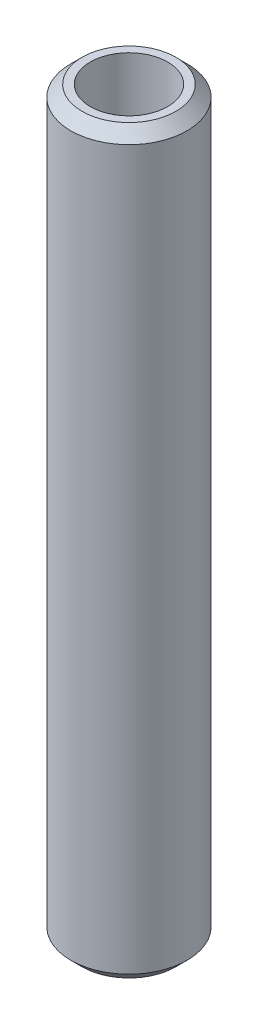
from build123d import *

# Parameters (mm, degrees)
SKETCH1_R           = 20
BOSS_EXTRUDE1_DEPTH = 254.898957635
SKETCH2_R           = 13.310604037
CUT_EXTRUDE1_DEPTH  = 257.463405973
CHAMFER1_SIZE       = 3.861478289


with BuildPart() as part:
    # Sketch1 → Boss-Extrude1 (new body)
    with BuildSketch(Plane(origin=(0, 0, 0), x_dir=(1, 0, 0), z_dir=(0, 1, 0))):
        Circle(SKETCH1_R)
    extrude(amount=BOSS_EXTRUDE1_DEPTH)

    # Sketch2 → Cut-Extrude1 (cut, through all)
    with BuildSketch(Plane(origin=(0, 0, 0), x_dir=(1, 0, 0), z_dir=(0, 1, 0))):
        Circle(SKETCH2_R)
    extrude(amount=CUT_EXTRUDE1_DEPTH, mode=Mode.SUBTRACT)

    # Chamfer1
    chamfer1_edges = [part.edges().sort_by_distance(p)[0] for p in [
        (-20, 254.898957635, 0),
        (-20, 0, 0),
    ]]
    chamfer(chamfer1_edges, length=CHAMFER1_SIZE)


solid = part.part
